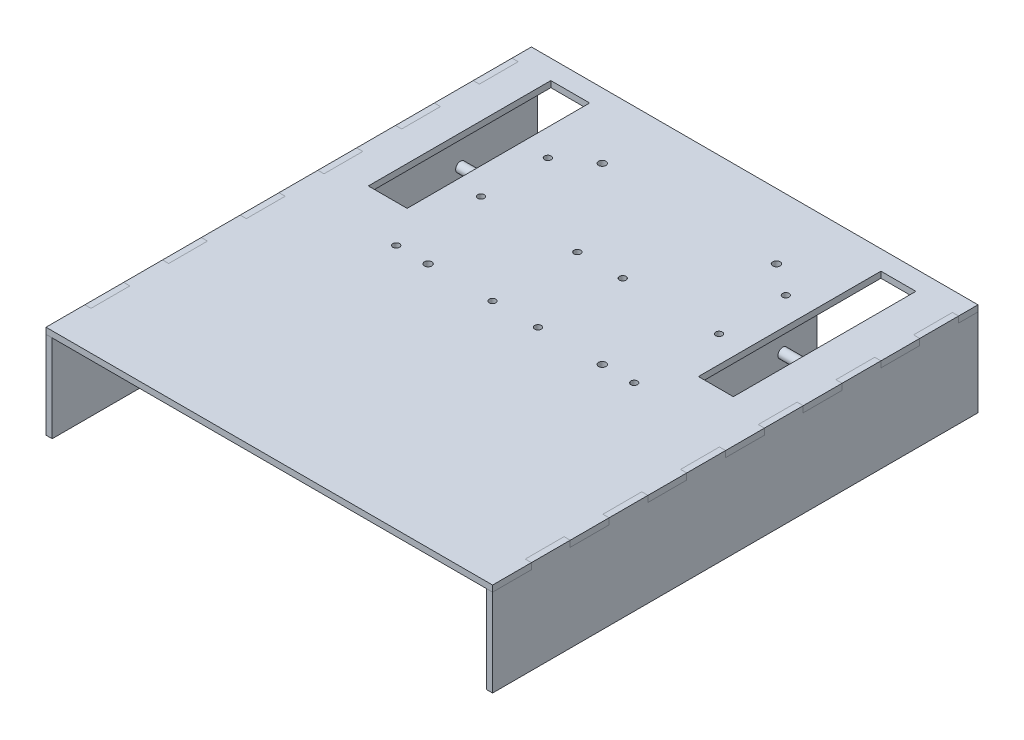
from build123d import *

# Parameters (mm, degrees)
SKETCH2_W           = 18
SKETCH2_H           = 94
SKETCH2_W_2         = 20
BOSS_EXTRUDE1_DEPTH = 3.175
BOSS_EXTRUDE2_DEPTH = 3.175
BOSS_EXTRUDE3_DEPTH = 1.6129
SKETCH6_R           = 1.27
SKETCH6_R_2         = 2.3749
SKETCH6_R_3         = 2.55
BOSS_EXTRUDE4_DEPTH = 1.6129
SKETCH7_R           = 1.7
SKETCH7_R_2         = 1.9
CUT_EXTRUDE1_DEPTH  = 10
SKETCH9_R           = 2.5
BOSS_EXTRUDE6_DEPTH = 189


with BuildPart() as part:
    # Sketch2 → Boss-Extrude1 (new body)
    with BuildSketch(Plane(origin=(0, 0, 0), x_dir=(1, 0, 0), z_dir=(0, 1, 0))):
        Polygon((-172.266187111, -88.214102909), (57.733812889, -88.214102909), (57.733812889, -68.214102909), (54.558812889, -68.214102909), (54.558812889, -48.214102909), (57.733812889, -48.214102909), (57.733812889, -28.214102909), (54.558812889, -28.214102909), (54.558812889, -8.214102909), (57.733812889, -8.214102909), (57.733812889, 11.785897091), (54.558812889, 11.785897091), (54.558812889, 31.785897091), (57.733812889, 31.785897091), (57.733812889, 51.785897091), (54.558812889, 51.785897091), (54.558812889, 71.785897091), (57.733812889, 71.785897091), (57.733812889, 91.785897091), (54.558812889, 91.785897091), (54.558812889, 111.785897091), (57.733812889, 111.785897091), (57.733812889, 131.785897091), (54.558812889, 131.785897091), (54.558812889, 151.785897091), (57.733812889, 151.785897091), (57.733812889, 161.785897091), (-172.266187111, 161.785897091), (-172.266187111, 151.785897091), (-169.091187111, 151.785897091), (-169.091187111, 131.785897091), (-172.266187111, 131.785897091), (-172.266187111, 111.785897091), (-169.091187111, 111.785897091), (-169.091187111, 91.785897091), (-172.266187111, 91.785897091), (-172.266187111, 71.785897091), (-169.091187111, 71.785897091), (-169.091187111, 51.785897091), (-172.266187111, 51.785897091), (-172.266187111, 31.785897091), (-169.091187111, 31.785897091), (-169.091187111, 11.785897091), (-172.266187111, 11.785897091), (-172.266187111, -8.214102909), (-169.091187111, -8.214102909), (-169.091187111, -28.214102909), (-172.266187111, -28.214102909), (-172.266187111, -48.214102909), (-169.091187111, -48.214102909), (-169.091187111, -68.214102909), (-172.266187111, -68.214102909), align=None)
        with Locations((26.733812889, 104.785897091)):
            Rectangle(SKETCH2_W, SKETCH2_H, mode=Mode.SUBTRACT)
        with Locations((-142.266187111, 104.785897091)):
            Rectangle(SKETCH2_W_2, SKETCH2_H, mode=Mode.SUBTRACT)
    extrude(amount=BOSS_EXTRUDE1_DEPTH)


with BuildPart() as body_2:
    # Sketch3 → Boss-Extrude2 (new body)
    with BuildSketch(Plane.ZY.offset(169.091187111)):
        Polygon((68.214102909, 3.175), (68.214102909, 0), (88.214102909, 0), (88.214102909, -45), (-161.732040232, -45), (-161.732040232, 0), (-151.785897091, 0), (-151.785897091, 3.175), (-131.785897091, 3.175), (-131.785897091, 0), (-111.785897091, 0), (-111.785897091, 3.175), (-91.785897091, 3.175), (-91.785897091, 0), (-71.785897091, 0), (-71.785897091, 3.175), (-51.785897091, 3.175), (-51.785897091, 0), (-31.785897091, 0), (-31.785897091, 3.175), (-11.785897091, 3.175), (-11.785897091, 0), (8.214102909, 0), (8.214102909, 3.175), (28.214102909, 3.175), (28.214102909, 0), (48.214102909, 0), (48.214102909, 3.175), align=None)
    extrude(amount=BOSS_EXTRUDE2_DEPTH)


with BuildPart() as body_3:
    # Sketch4 → Boss-Extrude3 (new body)
    with BuildSketch(Plane.XZ):
        Polygon((-128.266187111, -122.812619878), (-128.266187111, -33.510319411), (-110.428738975, -33.510319411), (-110.428738975, -55.404375385), (-73.179527552, -55.404375385), (-73.179527552, -32.986733746), (-64.765041143, -32.986733746), (-64.765041143, -87.177277304), (-73.179527552, -87.177277304), (-73.179527552, -65.404375385), (-110.42560363, -65.404375385), (-110.42560363, -122.812619878), align=None)
    extrude(amount=BOSS_EXTRUDE3_DEPTH)

    # Sketch6 → Boss-Extrude4 (add)
    with BuildSketch(Plane(origin=(-128.266187111, 113.834921078, 0), x_dir=(0, -1, 0), z_dir=(1, 0, 0))):
        with BuildLine():
            Line((135.755040524, 122.812619878), (113.834921078, 122.812619878))
            Line((113.834921078, 122.812619878), (113.834921078, 33.510319411))
            Line((113.834921078, 33.510319411), (133.404101078, 33.510319411))
            ThreePointArc((133.404101078, 33.510319411), (151.380719154, 59.699448377), (135.755040524, 87.355685301))
            Line((135.755040524, 87.355685301), (135.755040524, 122.812619878))
        make_face()
        with Locations((123.193301078, 51.685825385)):
            Circle(SKETCH6_R, mode=Mode.SUBTRACT)
        with Locations((133.404101078, 51.685825385)):
            Circle(SKETCH6_R_2, mode=Mode.SUBTRACT)
        with Locations((143.614901078, 51.685825385)):
            Circle(SKETCH6_R, mode=Mode.SUBTRACT)
        with Locations((133.404101078, 73.860025385)):
            Circle(SKETCH6_R, mode=Mode.SUBTRACT)
        with Locations((125.834921078, 105.254818177)):
            Circle(SKETCH6_R_3, mode=Mode.SUBTRACT)
    extrude(amount=BOSS_EXTRUDE4_DEPTH)


with BuildPart() as cut_extrude1_tool:
    # Sketch7 → Cut-Extrude1 (new body)
    with BuildSketch(Plane.XZ.offset(1.6129)):
        with Locations((-118.541013043, -82.124992621)):
            Circle(SKETCH7_R)
        with Locations((-118.541013043, -38.429929163)):
            Circle(SKETCH7_R)
        with Locations((-68.972284348, -38.429929163)):
            Circle(SKETCH7_R)
        with Locations((-68.972284348, -82.124992621)):
            Circle(SKETCH7_R)
        with Locations((-118.541013043, -116.547553094)):
            Circle(SKETCH7_R)
        with Locations((-102.118387528, -38.429929163)):
            Circle(SKETCH7_R_2)
        with Locations((-102.118387528, -128.129929163)):
            Circle(SKETCH7_R_2)
    cut_extrude1 = extrude(amount=-CUT_EXTRUDE1_DEPTH)


with BuildPart() as part_1:
    add(part.part)

    # Cut-Extrude1: cut by cut_extrude1_tool
    add(cut_extrude1_tool.part, mode=Mode.SUBTRACT)

    # Mirror2: Cut-Extrude1 across plane
    add(cut_extrude1.mirror(Plane.ZY.offset(57.266187111)), mode=Mode.SUBTRACT)


with BuildPart() as body_3_1:
    add(body_3.part)

    # Cut-Extrude1: cut by cut_extrude1_tool
    add(cut_extrude1_tool.part, mode=Mode.SUBTRACT)


with BuildPart() as body_4:
    # Mirror1: mirrored copy
    add(body_3_1.part.mirror(Plane.ZY.offset(57.266187111)))


with BuildPart() as body_5:
    # Mirror1 2: mirrored copy
    add(body_2.part.mirror(Plane.ZY.offset(57.266187111)))


with BuildPart() as body_6:
    # Sketch9 → Boss-Extrude6 (new body)
    with BuildSketch(Plane(origin=(-152.266187111, 0, 0), x_dir=(0, 0, -1), z_dir=(1, 0, 0))):
        with Locations((105.254818177, -12)):
            Circle(SKETCH9_R)
    extrude(amount=BOSS_EXTRUDE6_DEPTH)


solid = Compound([body_2.part, part_1.part, body_3_1.part, body_4.part, body_5.part, body_6.part])
